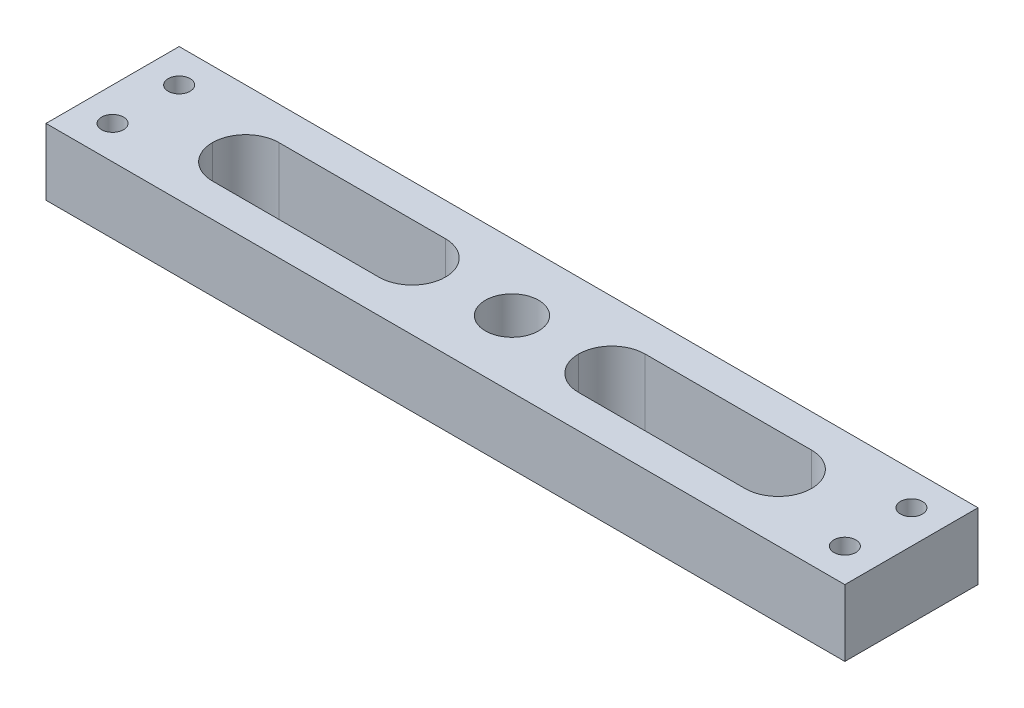
from build123d import *

# Parameters (mm, degrees)
SKETCH1_W             = 120
SKETCH1_H             = 20
SKETCH1_R             = 4
SKETCH1_W_2           = 35
SKETCH1_H_2           = 10
BOSS_EXTRUDE1_DEPTH   = 10
FILLET1_R             = 5
M4X0_7_TAPPED_HOLE1_D = 3.3


with BuildPart() as part:
    # Sketch1 → Boss-Extrude1 (new body)
    with BuildSketch(Plane(origin=(0, 0, 0), x_dir=(1, 0, 0), z_dir=(0, 1, 0))):
        with Locations((-60, -10)):
            Rectangle(SKETCH1_W, SKETCH1_H)
        with Locations(Location((-60, -10, 0), (0, 0, 270))):
            Circle(SKETCH1_R, mode=Mode.SUBTRACT)
        with Locations((-87.5, -10)):
            Rectangle(SKETCH1_W_2, SKETCH1_H_2, mode=Mode.SUBTRACT)
        with Locations((-32.5, -10)):
            Rectangle(SKETCH1_W_2, SKETCH1_H_2, mode=Mode.SUBTRACT)
    extrude(amount=BOSS_EXTRUDE1_DEPTH)

    # Fillet1
    fillet1_edges = [part.edges().sort_by_distance(p)[0] for p in [
        (-15, 5, 15),
        (-15, 5, 5),
        (-50, 5, 15),
        (-50, 5, 5),
        (-105, 5, 5),
        (-105, 5, 15),
        (-70, 5, 5),
        (-70, 5, 15),
    ]]
    fillet(fillet1_edges, radius=FILLET1_R - 0.0001)  # a hair under: the kernel refuses the full size

    # M4x0.7 Tapped Hole1 (through all)
    with Locations(Plane(origin=(0, 10, 0), x_dir=(1, 0, 0), z_dir=(0, 1, 0))):
        with Locations((-115, -5), (-115, -15), (-5, -5), (-5, -15)):
            Hole(M4X0_7_TAPPED_HOLE1_D / 2)


solid = part.part
